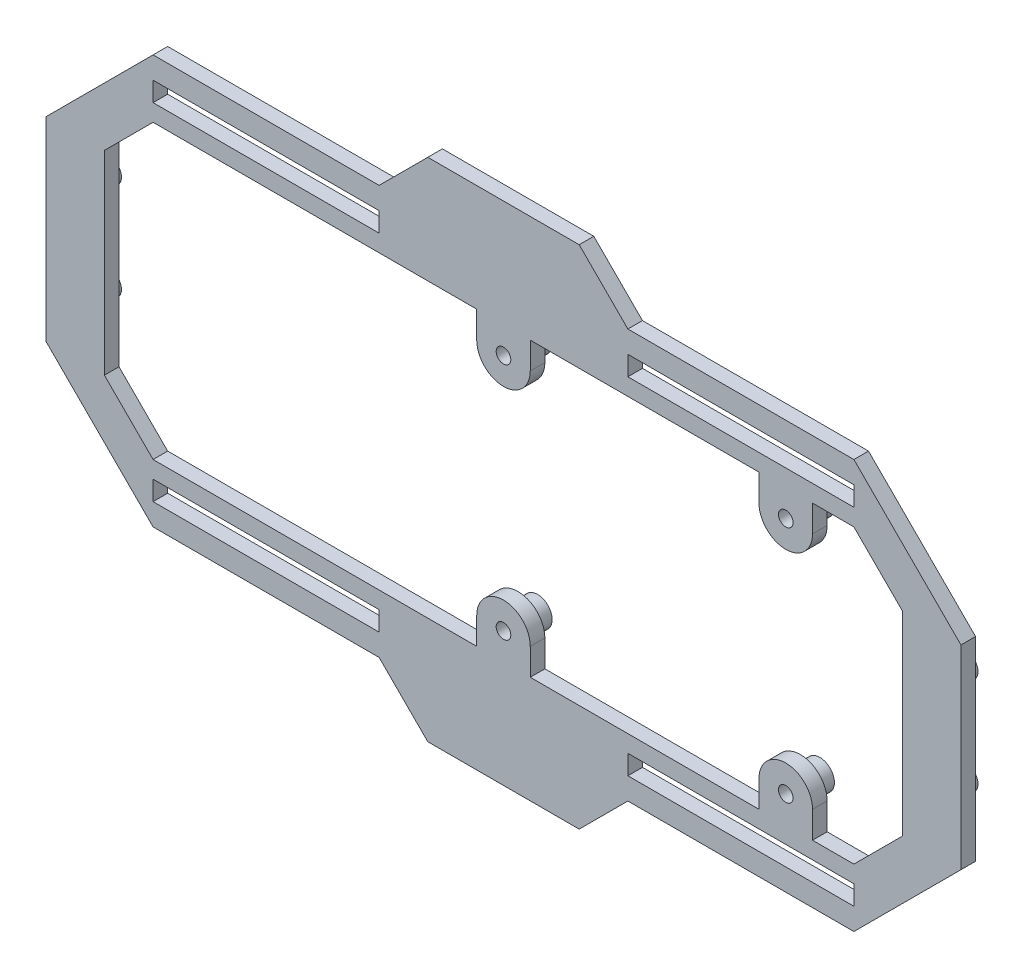
from build123d import *

# Parameters (mm, degrees)
BASE_FLANGE1_OUTLINE_R = 1.5
BASE_FLANGE1_DEPTH     = 3
SKETCH3_R              = 3
SKETCH3_R_2            = 1.5
BOSS_EXTRUDE1_DEPTH    = 4
SKETCH4_R              = 2.5
BOSS_EXTRUDE2_DEPTH    = 4
CROQUIS1_W             = 46.44
CROQUIS1_H             = 4
CORTAR_EXTRUIR1_DEPTH  = 108.498834907


# Read off the part's stored shape, not the designer's step: Base-Flange1
with BuildPart() as part:
    # Base-Flange1 outline → Base-Flange1 (new body)
    with BuildSketch(Plane(origin=(0, 0, 12.500000186), x_dir=(-1, 0, 0), z_dir=(0, 0, -1))):
        Polygon((-93.999996781, 19.999999553), (-93.999996781, -19.999999553), (-71.999996901, -41.999999434), (-25.556499138, -41.999999434), (-15.556500293, -52.000001073), (15.556500293, -52.000001073), (25.556499138, -41.999999434), (71.999996901, -41.999999434), (93.999996781, -19.999999553), (93.999996781, 19.999999553), (71.999996901, 41.999999434), (25.556499138, 41.999999434), (15.556500293, 52.000001073), (-15.556500293, 52.000001073), (-25.556499138, 41.999999434), (-71.999996901, 41.999999434), align=None)
        with Locations((-58, -24.5)):
            Circle(BASE_FLANGE1_OUTLINE_R, mode=Mode.SUBTRACT)
        with Locations((0, -24.5)):
            Circle(BASE_FLANGE1_OUTLINE_R, mode=Mode.SUBTRACT)
        with Locations((-58, 24.5)):
            Circle(BASE_FLANGE1_OUTLINE_R, mode=Mode.SUBTRACT)
        with BuildLine():
            Line((-81.999996781, 19.999999553), (-71.999996901, 29.999999434))
            Line((-71.999996901, 29.999999434), (-63.499999434, 29.999999434))
            Line((-63.499999434, 29.999999434), (-63.499999434, 24.5))
            ThreePointArc((-63.499999434, 24.5), (-58, 19.000000566), (-52.500000566, 24.5))
            Line((-52.500000566, 24.5), (-52.500000566, 29.999999434))
            Line((-52.500000566, 29.999999434), (-5.499999434, 29.999999434))
            Line((-5.499999434, 29.999999434), (-5.499999434, 24.5))
            ThreePointArc((-5.499999434, 24.5), (0, 19.000000566), (5.499999434, 24.5))
            Line((5.499999434, 24.5), (5.499999434, 29.999999434))
            Line((5.499999434, 29.999999434), (71.999996901, 29.999999434))
            Line((71.999996901, 29.999999434), (81.999996781, 19.999999553))
            Line((81.999996781, 19.999999553), (81.999996781, -19.999999553))
            Line((81.999996781, -19.999999553), (71.999996901, -29.999999434))
            Line((71.999996901, -29.999999434), (5.499999434, -29.999999434))
            Line((5.499999434, -29.999999434), (5.499999434, -24.5))
            ThreePointArc((5.499999434, -24.5), (0, -19.000000566), (-5.499999434, -24.5))
            Line((-5.499999434, -24.5), (-5.499999434, -29.999999434))
            Line((-5.499999434, -29.999999434), (-52.500000566, -29.999999434))
            Line((-52.500000566, -29.999999434), (-52.500000566, -24.5))
            ThreePointArc((-52.500000566, -24.5), (-58, -19.000000566), (-63.499999434, -24.5))
            Line((-63.499999434, -24.5), (-63.499999434, -29.999999434))
            Line((-63.499999434, -29.999999434), (-71.999996901, -29.999999434))
            Line((-71.999996901, -29.999999434), (-81.999996781, -19.999999553))
            Line((-81.999996781, -19.999999553), (-81.999996781, 19.999999553))
        make_face(mode=Mode.SUBTRACT)
        with Locations((0, 24.5)):
            Circle(BASE_FLANGE1_OUTLINE_R, mode=Mode.SUBTRACT)
    extrude(amount=BASE_FLANGE1_DEPTH)

    # Sketch3 → Boss-Extrude1 (add)
    # profile 1 of 4: a face of its own
    with BuildSketch(Plane(origin=(0, 0, 9.500000186), x_dir=(-1, 0, 0), z_dir=(0, 0, -1))):
        with Locations((-58, 24.5)):
            Circle(SKETCH3_R)
        with Locations((-58, 24.5)):
            Circle(SKETCH3_R_2, mode=Mode.SUBTRACT)
    # profile 2 of 4: a face of its own
    with BuildSketch(Plane(origin=(0, 0, 9.500000186), x_dir=(-1, 0, 0), z_dir=(0, 0, -1))):
        with Locations(Location((0, 24.5, 0), (0, 0, 180))):
            Circle(SKETCH3_R)
        with Locations(Location((0, 24.5, 0), (0, 0, 180))):
            Circle(SKETCH3_R_2, mode=Mode.SUBTRACT)
    # profile 3 of 4: a face of its own
    with BuildSketch(Plane(origin=(0, 0, 9.500000186), x_dir=(-1, 0, 0), z_dir=(0, 0, -1))):
        with Locations((0, -24.5)):
            Circle(SKETCH3_R)
        with Locations((0, -24.5)):
            Circle(SKETCH3_R_2, mode=Mode.SUBTRACT)
    # profile 4 of 4: a face of its own
    with BuildSketch(Plane(origin=(0, 0, 9.500000186), x_dir=(-1, 0, 0), z_dir=(0, 0, -1))):
        with Locations(Location((-58, -24.5, 0), (0, 0, 180))):
            Circle(SKETCH3_R)
        with Locations(Location((-58, -24.5, 0), (0, 0, 180))):
            Circle(SKETCH3_R_2, mode=Mode.SUBTRACT)
    extrude(amount=BOSS_EXTRUDE1_DEPTH)

    # Sketch4 → Boss-Extrude2 (add)
    with BuildSketch(Plane(origin=(0, 0, 9.500000186), x_dir=(-1, 0, 0), z_dir=(0, 0, -1))):
        with Locations((-87.999996781, 10)):
            Circle(SKETCH4_R)
        with Locations(Location((-87.999996781, -10, 0), (0, 0, 180))):
            Circle(SKETCH4_R)
        with Locations((87.999996781, -10)):
            Circle(SKETCH4_R)
        with Locations(Location((87.999996781, 10, 0), (0, 0, 180))):
            Circle(SKETCH4_R)
    extrude(amount=BOSS_EXTRUDE2_DEPTH)

    # Croquis1 → Cortar-Extruir1 (cut, through all)
    with BuildSketch(Plane(origin=(0, 0, 9.500000186), x_dir=(-1, 0, 0), z_dir=(0, 0, -1))):
        with Locations((-48.779996901, -35.499999434)):
            Rectangle(CROQUIS1_W, CROQUIS1_H)
        with Locations((48.779996901, -35.499999434)):
            Rectangle(CROQUIS1_W, CROQUIS1_H)
        with Locations((48.779996901, 35.499999434)):
            Rectangle(CROQUIS1_W, CROQUIS1_H)
        with Locations((-48.779996901, 35.499999434)):
            Rectangle(CROQUIS1_W, CROQUIS1_H)
    extrude(amount=-CORTAR_EXTRUIR1_DEPTH, mode=Mode.SUBTRACT)


solid = part.part
